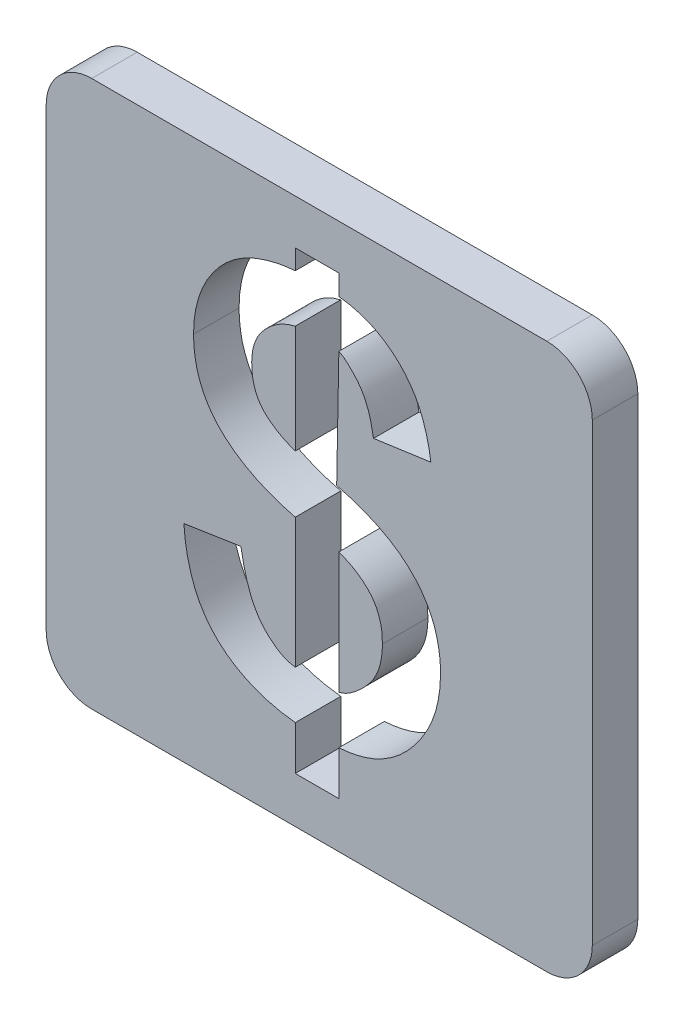
from build123d import *

# Parameters (mm, degrees)
BOSS_EXTRUDE1_DEPTH = 10
CUT_EXTRUDE12_START = -10
CUT_EXTRUDE12_DEPTH = 10


# Read off the part's stored shape, not the designer's step: Cut-Extrude12
with BuildPart() as part:
    # Sketch1 → Boss-Extrude1 (new body)
    with BuildSketch(Plane.XY):
        with BuildLine():
            Line((-50, 60), (50, 60))
            ThreePointArc((50, 60), (57.071067812, 57.071067812), (60, 50))
            Line((60, 50), (60, -50))
            ThreePointArc((60, -50), (57.071067812, -57.071067812), (50, -60))
            Line((50, -60), (-50, -60))
            ThreePointArc((-50, -60), (-57.071067812, -57.071067812), (-60, -50))
            Line((-60, -50), (-60, 50))
            ThreePointArc((-60, 50), (-57.071067812, 57.071067812), (-50, 60))
        make_face()
    extrude(amount=BOSS_EXTRUDE1_DEPTH)

    # Cut-Extrude12 outline → Cut-Extrude12 (cut)
    with BuildSketch(Plane.XY.offset(10).offset(CUT_EXTRUDE12_START)):
        with BuildLine():
            add(Edge.make_bspline(
                [(3.829899736, 9.469331853), (4.651101258, 9.255238705), (6.373065179, 8.800211267), (8.910934261, 7.982854414), (11.370568201, 6.996591048), (13.654680469, 5.93358143), (15.746006939, 4.757378698), (17.659586078, 3.474790317), (19.370064675, 2.073234039), (20.913516847, 0.590371796), (22.274195276, -0.997388115), (23.43779351, -2.704433385), (24.436709807, -4.500607784), (25.271405111, -6.398372377), (25.869216217, -8.413908853), (26.31913094, -10.520378408), (26.618016027, -12.727600555), (26.641728545, -14.23705148), (26.653846154, -15.008413462)],
                knots=[0.01036212, 0.01036212, 0.01036212, 0.01036212, 0.079332881, 0.155118053, 0.22688904, 0.294596679, 0.359746021, 0.421715561, 0.48158665, 0.539247834, 0.595485549, 0.651212183, 0.706865943, 0.762348073, 0.819345598, 0.877392597, 0.937344973, 1, 1, 1, 1], degree=3))
            Line((3.829899736, 9.469331853), (4.307692308, 35.237179487))
            add(Edge.make_bspline(
                [(11.922676282, 22.467948718), (11.756118771, 23.42078508), (11.442414071, 25.215415917), (10.668746906, 27.678761902), (9.747307562, 29.775480397), (8.588163562, 31.445492494), (7.410130151, 32.779570621), (6.303990971, 33.842612469), (5.324129932, 34.703821515), (4.625223761, 35.070560378), (4.307692308, 35.237179487)],
                knots=[0, 0, 0, 0, 0.187997623, 0.354086332, 0.501244759, 0.631642506, 0.747788284, 0.84692094, 0.930452157, 1, 1, 1, 1], degree=3))
            Line((11.922676282, 22.467948718), (24.525641026, 24.246995192))
            add(Edge.make_bspline(
                [(4.307692308, 45.662059295), (4.957696866, 45.577493429), (6.243982537, 45.410147125), (8.125446929, 44.993554081), (9.92902863, 44.428849803), (11.645548985, 43.709709033), (13.28315267, 42.854224926), (14.85468999, 41.876807221), (16.338865776, 40.732755063), (17.749840099, 39.463220808), (19.049720083, 38.041523481), (20.234930756, 36.492862307), (21.288928545, 34.80136789), (22.203523076, 32.963095038), (22.982943743, 30.98113234), (23.623379472, 28.859981153), (24.168134589, 26.608221373), (24.404467535, 25.047310905), (24.525641026, 24.246995192)],
                knots=[0, 0, 0, 0, 0.061357795, 0.121420152, 0.180181431, 0.238107144, 0.295441655, 0.353038633, 0.411166255, 0.470688067, 0.530559539, 0.591281942, 0.653059701, 0.716885302, 0.783285835, 0.852233503, 0.924236622, 1, 1, 1, 1], degree=3))
            Line((4.307692308, 45.662059295), (4.307692308, 50.134615385))
            Line((4.307692308, 50.134615385), (-5.269230769, 50.134615385))
            Line((-5.269230769, 50.134615385), (-5.269230769, 45.778445513))
            add(Edge.make_bspline(
                [(-27.615384615, 22.534455128), (-27.602748482, 23.283660324), (-27.577756275, 24.765465769), (-27.279217809, 26.938999246), (-26.834595345, 29.037892018), (-26.203213071, 31.054874397), (-25.380107075, 32.98670666), (-24.402120944, 34.851017323), (-23.207872424, 36.608309251), (-21.866273289, 38.295918436), (-20.346458111, 39.852364991), (-18.657456687, 41.24113319), (-16.809355132, 42.444954007), (-14.806911484, 43.482903512), (-12.638425501, 44.318779361), (-10.328369652, 45.008790952), (-7.857443216, 45.510911003), (-6.146911468, 45.687722715), (-5.269230769, 45.778445513)],
                knots=[0, 0, 0, 0, 0.062742301, 0.124094017, 0.183487802, 0.24239109, 0.30087542, 0.359258235, 0.418512032, 0.478642131, 0.53972959, 0.600445154, 0.661504357, 0.724236343, 0.789093431, 0.855954955, 0.92608991, 1, 1, 1, 1], degree=3))
            add(Edge.make_bspline(
                [(-5.269230769, -1.125200321), (-6.137019995, -0.897690659), (-7.842567008, -0.450544727), (-10.290281253, 0.389164268), (-12.595271169, 1.293897806), (-14.73580601, 2.317802511), (-16.733652862, 3.42736479), (-18.584240651, 4.637458518), (-20.27204064, 5.959006773), (-21.806820404, 7.371581142), (-23.183957959, 8.886886999), (-24.364565463, 10.524284334), (-25.376108886, 12.264514626), (-26.178064087, 14.117370849), (-26.850827695, 16.062441252), (-27.275834031, 18.130892044), (-27.580156931, 20.297465856), (-27.603496905, 21.779574935), (-27.615384615, 22.534455128)],
                knots=[0, 0, 0, 0, 0.075844255, 0.14906378, 0.21869239, 0.28515057, 0.349567627, 0.411836178, 0.471936074, 0.530643634, 0.588057184, 0.644777819, 0.701053245, 0.757922797, 0.815282754, 0.874763549, 0.936213523, 1, 1, 1, 1], degree=3))
            Line((-5.269230769, -1.125200321), (-5.269230769, -29.673076923))
            add(Edge.make_bspline(
                [(-17.20713141, -12.647435897), (-17.08632667, -13.358103486), (-16.852172066, -14.735583268), (-16.402664345, -16.716844049), (-15.888887925, -18.541610498), (-15.327187544, -20.216203966), (-14.697345018, -21.735003901), (-14.001765082, -23.096687891), (-13.254039271, -24.310948037), (-12.191153535, -25.66682637), (-10.783612806, -27.070335372), (-9.01737936, -28.391176881), (-7.184967958, -29.322557123), (-5.898886501, -29.557869679), (-5.269230769, -29.673076923)],
                knots=[0, 0, 0, 0, 0.097084149, 0.188177222, 0.273492383, 0.352340669, 0.425958464, 0.494735062, 0.55811846, 0.61769945, 0.726439675, 0.824685012, 0.914167111, 1, 1, 1, 1], degree=3))
            Line((-17.20713141, -12.647435897), (-29.743589744, -14.576121795))
            add(Edge.make_bspline(
                [(-5.269230769, -40.214342949), (-6.152504611, -40.105581471), (-7.885148124, -39.892233289), (-10.402821078, -39.353955628), (-12.780954336, -38.657577725), (-15.018676957, -37.812241533), (-17.111032946, -36.802994053), (-19.08058104, -35.664362641), (-20.902183607, -34.343702464), (-22.570873783, -32.854991024), (-24.099322265, -31.209293922), (-25.42524832, -29.362444966), (-26.606838728, -27.355244963), (-27.578162277, -25.145624763), (-28.393281812, -22.758838626), (-29.037258654, -20.195622566), (-29.510737122, -17.449905769), (-29.664413014, -15.553292744), (-29.743589744, -14.576121795)],
                knots=[0, 0, 0, 0, 0.068062898, 0.133513224, 0.196710589, 0.25750662, 0.316300014, 0.374261821, 0.431343721, 0.488108177, 0.545127046, 0.602801199, 0.661709163, 0.723017629, 0.787114741, 0.854476625, 0.925023601, 1, 1, 1, 1], degree=3))
            Line((-5.269230769, -40.214342949), (-5.269230769, -49.891025641))
            Line((-5.269230769, -49.891025641), (4.307692308, -49.891025641))
            Line((4.307692308, -49.891025641), (4.307692308, -40.197716346))
            add(Edge.make_bspline(
                [(26.653846154, -15.008413462), (26.635668711, -15.802035053), (26.599690415, -17.372836449), (26.282633466, -19.690279279), (25.815106337, -21.950014152), (25.100127809, -24.129672631), (24.226389701, -26.259199608), (23.114288353, -28.301611461), (21.832102403, -30.291574777), (20.365057121, -32.184020449), (18.751397428, -33.942797936), (16.999051073, -35.49338187), (15.145875566, -36.833250571), (13.185970917, -37.956865389), (11.119361206, -38.862081523), (8.939264471, -39.516798484), (6.665053749, -40.001673764), (5.102568108, -40.131612989), (4.307692308, -40.197716346)],
                knots=[0, 0, 0, 0, 0.064082293, 0.126836967, 0.188659935, 0.250253877, 0.311868971, 0.374367568, 0.437829023, 0.502936996, 0.567572169, 0.630373145, 0.691634215, 0.752000314, 0.812555404, 0.87345381, 0.935622766, 1, 1, 1, 1], degree=3))
        make_face()
        with BuildLine():
            add(Edge.make_bspline(
                [(4.307692308, -29.673076923), (4.809999517, -29.50408965), (5.882907448, -29.143139653), (7.411725674, -28.132874023), (9.00773224, -26.816272645), (10.3184365, -25.45744691), (11.339462013, -24.217093709), (12.027830838, -23.185071901), (12.58287141, -22.076500272), (13.082257467, -20.924452078), (13.442178397, -19.69497539), (13.680544359, -18.406870485), (13.864485194, -17.064209311), (13.877786755, -16.145246178), (13.884615385, -15.673477564)],
                knots=[0, 0, 0, 0, 0.087571184, 0.187048516, 0.301323891, 0.430677181, 0.499294631, 0.567615943, 0.635856829, 0.704652579, 0.77561251, 0.847718078, 0.921822945, 1, 1, 1, 1], degree=3))
            Line((4.307692308, -29.673076923), (4.307692308, -2.9375))
            add(Edge.make_bspline(
                [(13.884615385, -15.673477564), (13.861276644, -14.878025485), (13.816754622, -13.360585586), (13.33326714, -11.211891668), (12.585421154, -9.296003879), (11.4577088, -7.648939589), (10.073004894, -6.205542924), (8.411562501, -4.929357307), (6.476245927, -3.81237526), (5.047387135, -3.23592043), (4.307692308, -2.9375)],
                knots=[0, 0, 0, 0, 0.138747891, 0.264681671, 0.38282422, 0.495893222, 0.610959817, 0.731050713, 0.860769729, 1, 1, 1, 1], degree=3))
        make_face(mode=Mode.SUBTRACT)
        with BuildLine():
            add(Edge.make_bspline(
                [(-5.269230769, 35.237179487), (-5.886361442, 35.069325676), (-7.119551097, 34.733909545), (-8.851804055, 33.852303433), (-10.484715507, 32.708860722), (-11.969797, 31.294446838), (-13.280862837, 29.670576278), (-14.171907462, 27.781767485), (-14.752076649, 25.733319294), (-14.814229335, 24.301006812), (-14.846153846, 23.565304487)],
                knots=[0, 0, 0, 0, 0.117427758, 0.234651595, 0.35547186, 0.483173361, 0.611090543, 0.736987217, 0.864904399, 1, 1, 1, 1], degree=3))
            Line((-5.269230769, 35.237179487), (-5.269230769, 11.477764423))
            add(Edge.make_bspline(
                [(-14.846153846, 23.565304487), (-14.820564775, 22.741592722), (-14.772088924, 21.181155869), (-14.243474845, 19.003113998), (-13.419363639, 17.109994682), (-12.196547416, 15.556339307), (-10.716435235, 14.283601685), (-9.076995365, 13.161437362), (-7.252756905, 12.203139512), (-5.940602494, 11.723284921), (-5.269230769, 11.477764423)],
                knots=[0, 0, 0, 0, 0.147624976, 0.279660267, 0.399910368, 0.515563211, 0.631186078, 0.749329827, 0.871743093, 1, 1, 1, 1], degree=3))
        make_face(mode=Mode.SUBTRACT)
    extrude(amount=CUT_EXTRUDE12_DEPTH, mode=Mode.SUBTRACT)


solid = part.part
